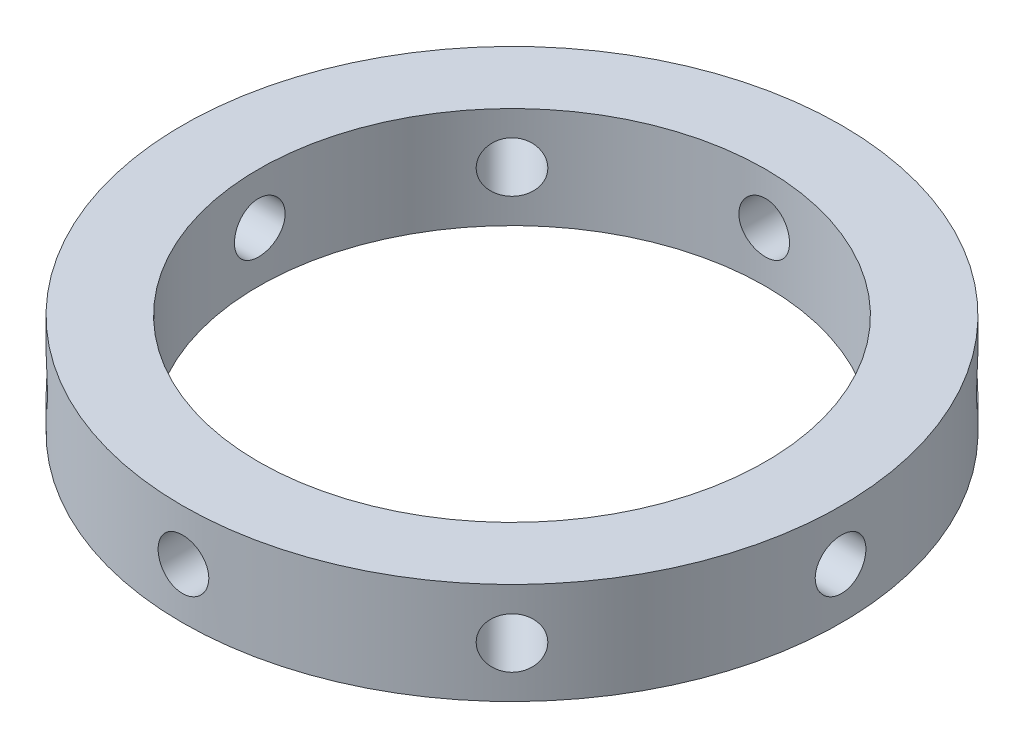
from build123d import *

# Parameters (mm, degrees)
SKETCH1_R           = 41.275
SKETCH1_R_2         = 31.75
BOSS_EXTRUDE1_DEPTH = 12.7
CIRPATTERN1_COUNT   = 8


with BuildPart() as part:
    # Sketch1 → Boss-Extrude1 (new body)
    with BuildSketch(Plane(origin=(0, 0, 0), x_dir=(1, 0, 0), z_dir=(0, 1, 0))):
        Circle(SKETCH1_R)
        Circle(SKETCH1_R_2, mode=Mode.SUBTRACT)
    extrude(amount=BOSS_EXTRUDE1_DEPTH)

    # Sketch3 → 1/4 (0.25) Diameter Hole1 (revolve, cut)
    with BuildSketch(Plane(origin=(0, 6.35, 41.275), x_dir=(0, -1, 0), z_dir=(1, 0, 0))):
        Polygon((0, 0), (0, 13.591732465), (3.175, 11.684), (3.175, 0), align=None)
    f_1_4_0_25_diameter_hole1 = revolve(axis=Axis((0, 6.35, 47.625), (0, 0, -1)), mode=Mode.SUBTRACT)

    # CirPattern1: 1/4 (0.25) Diameter Hole1 ×8 about axis
    cirpattern1_axis = Axis((0, -0.3175, 0), (0, 1, 0))
    for i in range(1, CIRPATTERN1_COUNT):
        add(f_1_4_0_25_diameter_hole1.rotate(cirpattern1_axis, i * 360 / CIRPATTERN1_COUNT), mode=Mode.SUBTRACT)


solid = part.part
